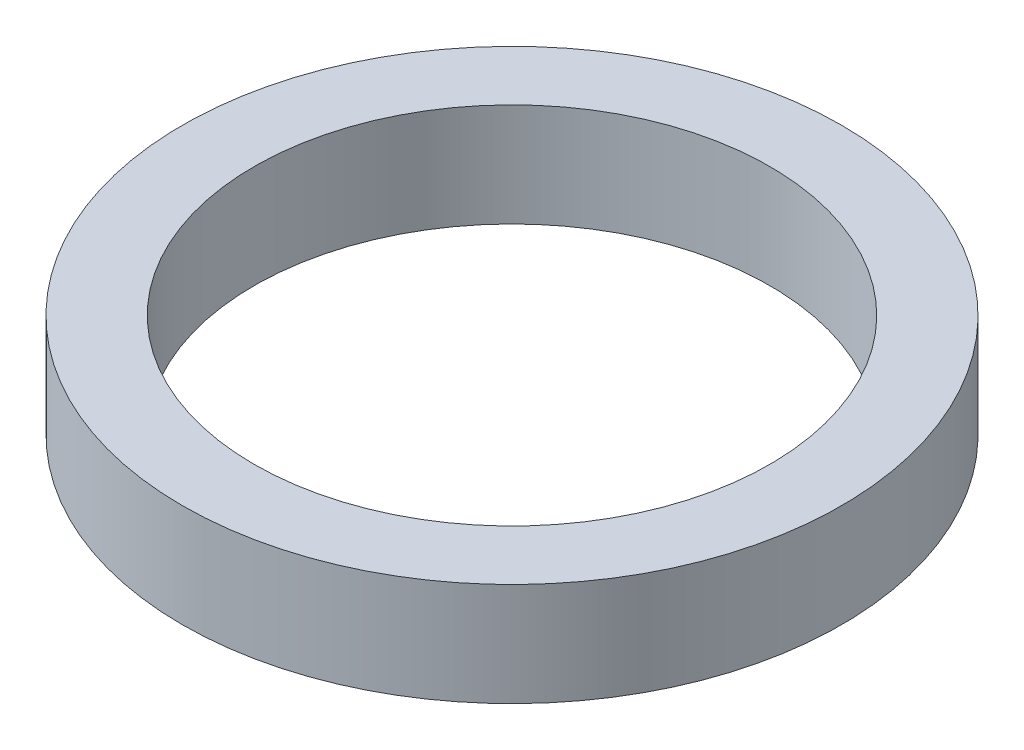
from build123d import *

# Parameters (mm, degrees)
SKETCH1_R           = 57.5
BOSS_EXTRUDE1_DEPTH = 18
SKETCH2_R           = 45
CUT_EXTRUDE1_DEPTH  = 84.285653026


with BuildPart() as part:
    # Sketch1 → Boss-Extrude1 (new body)
    with BuildSketch(Plane(origin=(0, 0, 0), x_dir=(1, 0, 0), z_dir=(0, 1, 0))):
        Circle(SKETCH1_R)
    extrude(amount=BOSS_EXTRUDE1_DEPTH)

    # Sketch2 → Cut-Extrude1 (cut, through all)
    with BuildSketch(Plane(origin=(0, 0, 0), x_dir=(1, 0, 0), z_dir=(0, 1, 0))):
        Circle(SKETCH2_R)
    extrude(amount=CUT_EXTRUDE1_DEPTH, mode=Mode.SUBTRACT)


solid = part.part
